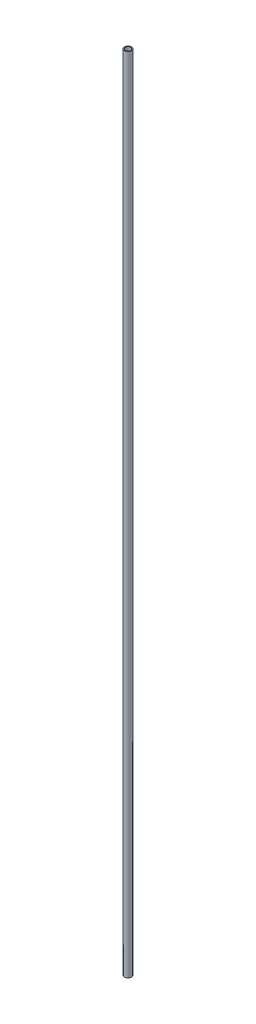
from build123d import *

# Parameters (mm, degrees)
SKETCH1_R           = 13.335
SKETCH1_R_2         = 10.2108
BOSS_EXTRUDE1_DEPTH = 3048


with BuildPart() as part:
    # Sketch1 → Boss-Extrude1 (new body)
    with BuildSketch(Plane(origin=(0, 0, 0), x_dir=(1, 0, 0), z_dir=(0, 1, 0))):
        Circle(SKETCH1_R)
        Circle(SKETCH1_R_2, mode=Mode.SUBTRACT)
    extrude(amount=BOSS_EXTRUDE1_DEPTH)


solid = part.part
